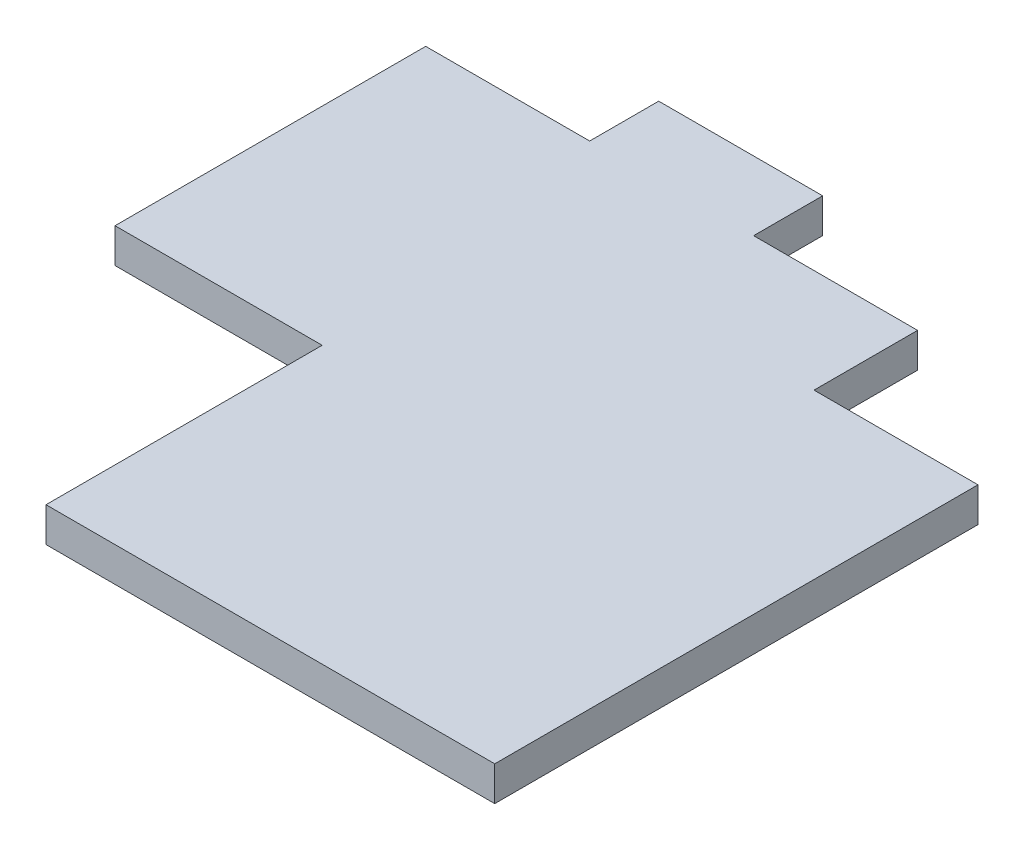
from build123d import *

# Parameters (mm, degrees)
BOSS_EXTRUDE1_DEPTH = 5


with BuildPart() as part:
    # Sketch1 → Boss-Extrude1 (new body)
    with BuildSketch(Plane(origin=(0, 0, 0), x_dir=(1, 0, 0), z_dir=(0, 1, 0))):
        Polygon((30, 0), (95, 0), (95, 70), (71.25, 70), (71.25, 85), (47.5, 85), (47.5, 95), (23.75, 95), (23.75, 85), (0, 85), (0, 40), (30, 40), align=None)
    extrude(amount=BOSS_EXTRUDE1_DEPTH)


solid = part.part
